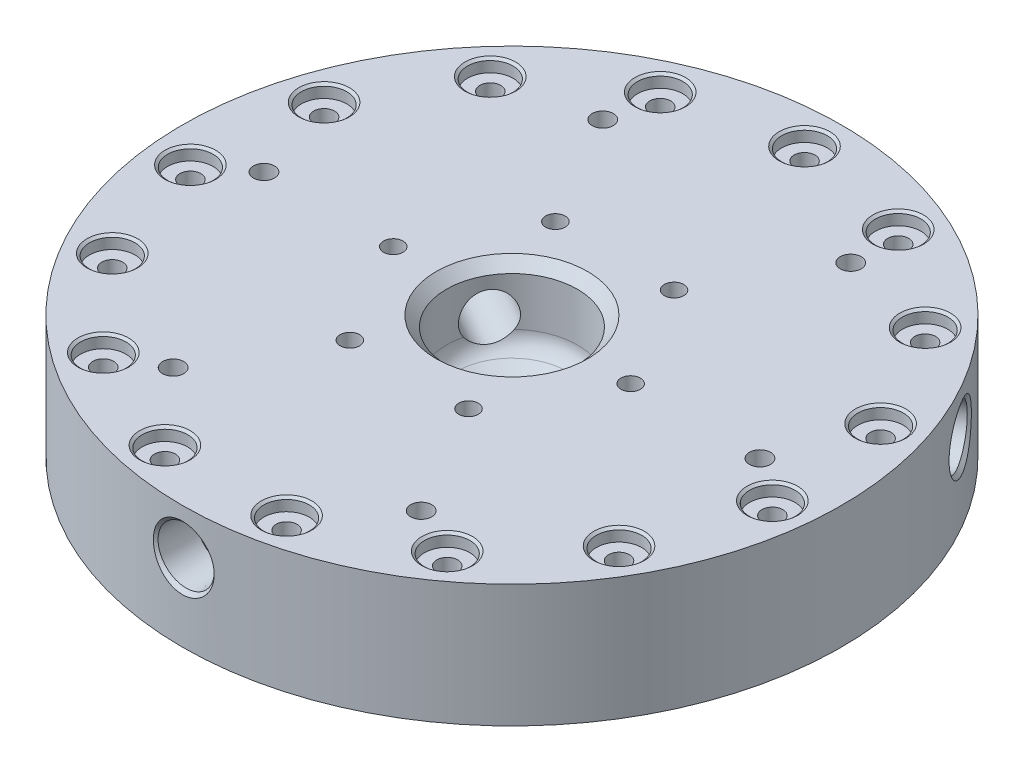
from build123d import *

# Parameters (mm, degrees)
SKETCH1_R           = 80.54
BOSS_EXTRUDE1_DEPTH = 30
CIRPATTERN1_COUNT   = 3
CIRPATTERN2_COUNT   = 15
CIRPATTERN3_COUNT   = 6
SKETCH21_W          = 5
SKETCH21_H          = 3
CHAMFER1_SIZE       = 2.5
CIRPATTERN4_COUNT   = 6


with BuildPart() as part:
    # Sketch1 → Boss-Extrude1 (new body)
    with BuildSketch(Plane(origin=(0, 0, 0), x_dir=(1, 0, 0), z_dir=(0, 1, 0))):
        Circle(SKETCH1_R)
    extrude(amount=BOSS_EXTRUDE1_DEPTH)

    # Sketch2 → Cut-Revolve1 (revolve, cut)
    with BuildSketch(Plane.XY):
        with BuildLine():
            Line((-5.95325, 0), (-5.95325, 4.113248654))
            ThreePointArc((-5.95325, 4.113248654), (-6.623122981, 6.613248654), (-8.45325, 8.443375673))
            Line((-8.45325, 8.443375673), (-13.5, 11.357118144))
            ThreePointArc((-13.5, 11.357118144), (-15.330127019, 13.187245163), (-16, 15.687245163))
            Line((-16, 15.687245163), (-16, 30))
            Line((-16, 30), (0, 30))
            Line((0, 30), (0, 0))
            Line((0, 0), (-5.95325, 0))
        make_face()
    revolve(axis=Axis((0, 30, 0), (0, -1, 0)), mode=Mode.SUBTRACT)

    # Sketch5 → 1/4 NPT Tapped Hole1 (revolve, cut)
    with BuildSketch(Plane(origin=(0, 18.904757199, 80.54), x_dir=(0, -1, 0), z_dir=(1, 0, 0))):
        Polygon((0, 0), (0, 83.882347279), (5.5626, 80.54), (5.5626, 10.02), (6.58554395, 10.02), (6.8579873, 0.9207627), (7.77875, 0), align=None)
    f_1_4_npt_tapped_hole1 = revolve(axis=Axis((0, 18.904757199, 86.89), (0, 0, -1)), mode=Mode.SUBTRACT)

    # CirPattern1: 1/4 NPT Tapped Hole1 ×3 about axis
    cirpattern1_axis = Axis((0, 30, 0), (0, -1, 0))
    for i in range(1, CIRPATTERN1_COUNT):
        add(f_1_4_npt_tapped_hole1.rotate(cirpattern1_axis, i * 360 / CIRPATTERN1_COUNT), mode=Mode.SUBTRACT)

    # Sketch7 → CBORE for #10 Binding Head Machine Screw1 (revolve, cut)
    with BuildSketch(Plane(origin=(0, 30, -71.5), x_dir=(0, 0, 1), z_dir=(1, 0, 0))):
        Polygon((0, 0), (0, 30), (2.5527, 30), (2.5527, 3.1242), (5.55625, 3.1242), (5.55625, 0.532828266), (6.19125, 0), align=None)
    cbore_for_10_binding_head_machine_screw = revolve(axis=Axis((0, 36.35, -71.5), (0, -1, 0)), mode=Mode.SUBTRACT)

    # CirPattern2: CBORE for #10 Binding Head Machine Screw1 ×15 about axis
    cirpattern2_axis = Axis((0, 30, 0), (0, -1, 0))
    for i in range(1, CIRPATTERN2_COUNT):
        add(cbore_for_10_binding_head_machine_screw.rotate(cirpattern2_axis, i * 360 / CIRPATTERN2_COUNT), mode=Mode.SUBTRACT)

    # Sketch19 → 13/64 (0.20313) Diameter Hole3 (revolve, cut)
    with BuildSketch(Plane(origin=(30.305, 30, -52.489799723), x_dir=(0, 0, 1), z_dir=(1, 0, 0))):
        Polygon((0, 0), (0, 14.250070783), (2.579751, 12.7), (2.579751, 0), align=None)
    f_13_64_0_20313_diameter_hole3 = revolve(axis=Axis((30.305, 36.35, -52.489799723), (0, -1, 0)), mode=Mode.SUBTRACT)

    # CirPattern3: 13/64 (0.20313) Diameter Hole3 ×6 about axis
    cirpattern3_axis = Axis((0, 30, 0), (0, -1, 0))
    for i in range(1, CIRPATTERN3_COUNT):
        add(f_13_64_0_20313_diameter_hole3.rotate(cirpattern3_axis, i * 360 / CIRPATTERN3_COUNT), mode=Mode.SUBTRACT)

    # Sketch21 → Cut-Revolve2 (revolve, cut)
    with BuildSketch(Plane.XY):
        with Locations((62.5, 1.5)):
            Rectangle(SKETCH21_W, SKETCH21_H)
    revolve(axis=Axis((0, 0, 0), (0, -1, 0)), mode=Mode.SUBTRACT)

    # Chamfer1
    chamfer1_edges = [part.edges().sort_by_distance(p)[0] for p in [
        (16, 30, 0),
    ]]
    chamfer(chamfer1_edges, length=CHAMFER1_SIZE)

    # Sketch28 → 3/16 (0.1875) Diameter Hole1 (revolve, cut)
    with BuildSketch(Plane(origin=(29, 30, 0), x_dir=(0, 0, 1), z_dir=(1, 0, 0))):
        Polygon((0, 0), (0, 13.430799349), (2.38125, 12), (2.38125, 0), align=None)
    f_3_16_0_1875_diameter_hole1 = revolve(axis=Axis((29, 36.35, 0), (0, -1, 0)), mode=Mode.SUBTRACT)

    # CirPattern4: 3/16 (0.1875) Diameter Hole1 ×6 about axis
    cirpattern4_axis = Axis((0, 30, 0), (0, -1, 0))
    for i in range(1, CIRPATTERN4_COUNT):
        add(f_3_16_0_1875_diameter_hole1.rotate(cirpattern4_axis, i * 360 / CIRPATTERN4_COUNT), mode=Mode.SUBTRACT)


solid = part.part
